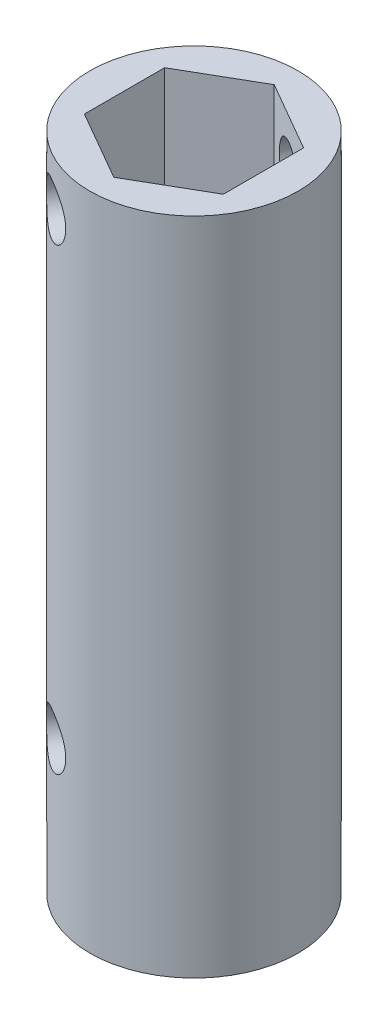
from build123d import *

# Parameters (mm, degrees)
SKETCH1_R               = 9.525
BOSS_EXTRUDE1_DEPTH     = 60.325
CUT_EXTRUDE1_DEPTH      = 65.716102786
CUT_EXTRUDE1_DEPTH_BACK = 65.716102786
SKETCH2_R               = 2.38125


with BuildPart() as part:
    # Sketch1 → Boss-Extrude1 (new body)
    with BuildSketch(Plane(origin=(0, 0, 0), x_dir=(1, 0, 0), z_dir=(0, 1, 0))):
        Circle(SKETCH1_R)
        Polygon((0, 7.332348419), (-6.35, 3.666174209), (-6.35, -3.666174209), (0, -7.332348419), (6.35, -3.666174209), (6.35, 3.666174209), align=None, mode=Mode.SUBTRACT)
    extrude(amount=BOSS_EXTRUDE1_DEPTH)

    # Sketch2 → Cut-Extrude1 (cut, two sides: drawn at the far end of the back side and taken through both)
    with BuildSketch(Plane(origin=(-5.08, 0, 8.798818102), x_dir=(-0.8660254037844388, 0, -0.4999999999999997), z_dir=(0.49999999999999983, 0, -0.8660254037844389)).offset(-CUT_EXTRUDE1_DEPTH_BACK)):
        with Locations((0, 55.88)):
            Circle(SKETCH2_R)
        with Locations((0, 13.97)):
            Circle(SKETCH2_R)
    extrude(amount=CUT_EXTRUDE1_DEPTH + CUT_EXTRUDE1_DEPTH_BACK, mode=Mode.SUBTRACT)


solid = part.part
